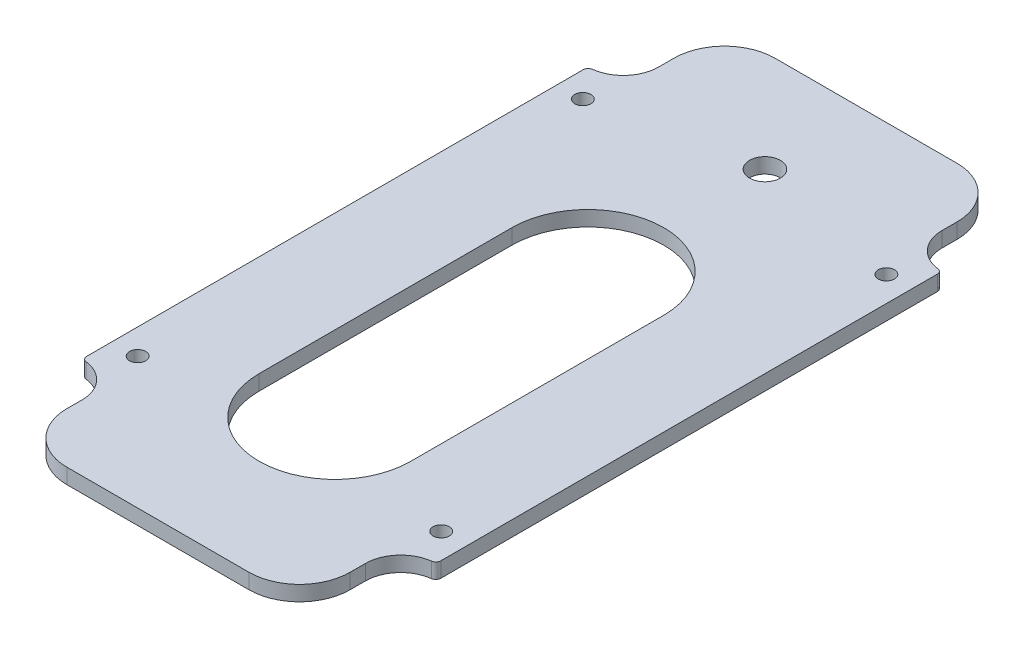
from build123d import *

# Parameters (mm, degrees)
SKETCH1_R           = 1.6
BOSS_EXTRUDE1_DEPTH = 3
FILLET1_R           = 7
FILLET2_R           = 1
FILLET3_R           = 50
SKETCH2_W           = 59.626658502
SKETCH2_H           = 94.260753609
CUT_EXTRUDE1_DEPTH  = 10
FILLET4_R           = 10
SKETCH3_R           = 3.048
CUT_EXTRUDE2_DEPTH  = 10


with BuildPart() as part:
    # Sketch1 → Boss-Extrude1 (new body)
    with BuildSketch(Plane(origin=(0, 0, 0), x_dir=(1, 0, 0), z_dir=(0, 1, 0))):
        Polygon((-35, -50), (-28, -50), (-28, -132), (0, -144), (28, -132), (28, -50), (35, -50), (35, 50), (28, 50), (28, 132), (0, 144), (-28, 132), (-28, 50), (-35, 50), align=None)
        with Locations(Location((-30, 44, 0), (0, 0, 270))):
            Circle(SKETCH1_R, mode=Mode.SUBTRACT)
        with Locations(Location((30, 44, 0), (0, 0, 270))):
            Circle(SKETCH1_R, mode=Mode.SUBTRACT)
        with Locations(Location((30, -44, 0), (0, 0, 270))):
            Circle(SKETCH1_R, mode=Mode.SUBTRACT)
        with Locations(Location((-30, -44, 0), (0, 0, 270))):
            Circle(SKETCH1_R, mode=Mode.SUBTRACT)
    extrude(amount=BOSS_EXTRUDE1_DEPTH)

    # Fillet1
    fillet1_edges = [part.edges().sort_by_distance(p)[0] for p in [
        (-28, 1.5, 50),
        (28, 1.5, 50),
        (28, 1.5, -50),
        (-28, 1.5, -50),
    ]]
    fillet(fillet1_edges, radius=FILLET1_R - 0.0001)  # a hair under: the kernel refuses the full size

    # Fillet2
    fillet2_edges = [part.edges().sort_by_distance(p)[0] for p in [
        (35, 1.5, -50),
        (35, 1.5, 50),
        (-35, 1.5, 50),
        (-35, 1.5, -50),
    ]]
    fillet(fillet2_edges, radius=FILLET2_R)

    # Fillet3
    fillet3_edges = [part.edges().sort_by_distance(p)[0] for p in [
        (0, 1.5, 144),
        (0, 1.5, -144),
    ]]
    fillet(fillet3_edges, radius=FILLET3_R)

    # Sketch2 → Cut-Extrude1 (cut)
    with BuildSketch(Plane(origin=(0, 3, 0), x_dir=(1, 0, 0), z_dir=(0, 1, 0))):
        with Locations((1.813329251, 117.130376805)):
            Rectangle(SKETCH2_W, SKETCH2_H)
    cut_extrude1 = extrude(amount=-CUT_EXTRUDE1_DEPTH, mode=Mode.SUBTRACT)

    # Mirror1: Cut-Extrude1 across plane
    add(cut_extrude1.mirror(Plane.XY), mode=Mode.SUBTRACT)

    # Fillet4
    fillet4_edges = [part.edges().sort_by_distance(p)[0] for p in [
        (-28, 1.5, -70),
        (28, 1.5, -70),
        (28, 1.5, 70),
        (-28, 1.5, 70),
    ]]
    fillet(fillet4_edges, radius=FILLET4_R)

    # Sketch3 → Cut-Extrude2 (cut)
    with BuildSketch(Plane(origin=(0, 3, 0), x_dir=(1, 0, 0), z_dir=(0, 1, 0))):
        with Locations(Location((0, 50, 0), (0, 0, 270))):
            Circle(SKETCH3_R)
        with BuildLine():
            Line((15, 15), (15, -35))
            ThreePointArc((15, -35), (0, -50), (-15, -35))
            Line((-15, -35), (-15, 15))
            ThreePointArc((-15, 15), (0, 30), (15, 15))
        make_face()
    extrude(amount=-CUT_EXTRUDE2_DEPTH, mode=Mode.SUBTRACT)


solid = part.part
